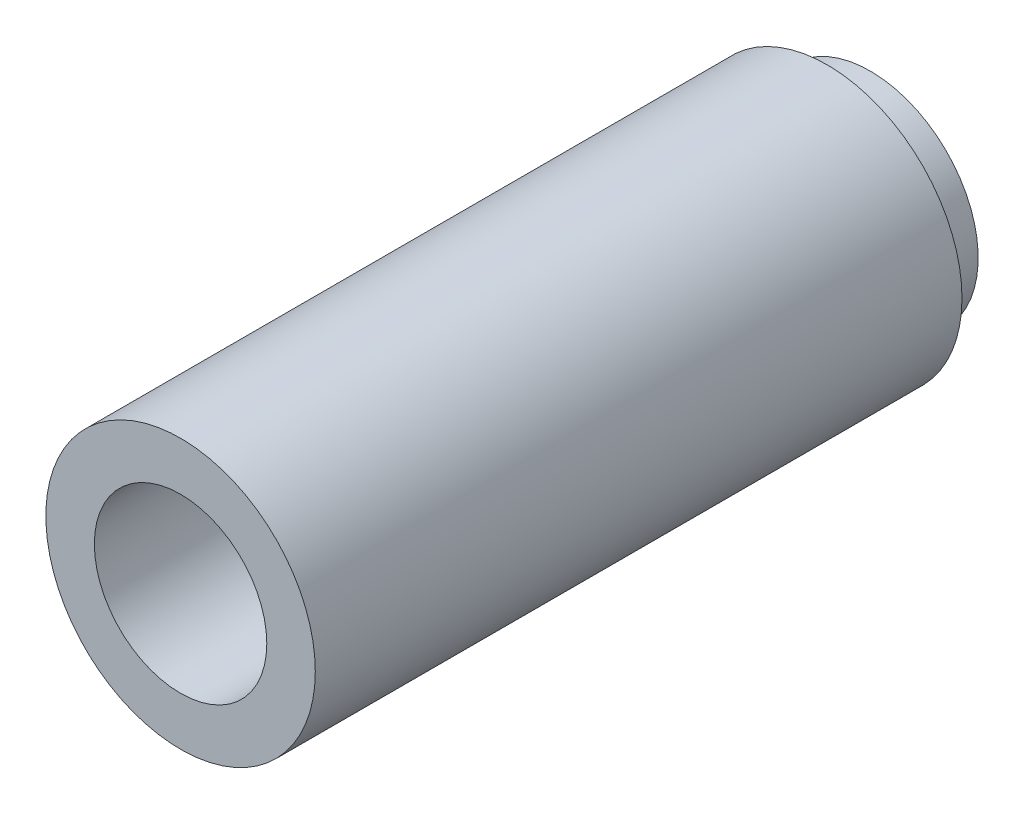
from build123d import *

# Parameters (mm, degrees)
SKETCH_1_R            = 12.5
EXTRUDE_1_DEPTH       = 60
SKETCH_2_R            = 10
EXTRUDE_2_DEPTH       = 4
OTHER_START           = 45
OTHER_1_OUTLINE_R     = 8
OTHER_1_DEPTH         = 15
M10X1_251_D           = 8.8
M10X1_251_DEPTH       = 40
M10X1_251_CBORE_D     = 10
M10X1_251_CBORE_DEPTH = 20
M10X1_251_TIP         = 2.643786724


# Read off the part's stored shape, not the designer's step: Полость1
with BuildPart() as part:
    # Эскиз1 → Бобышка-Вытянуть1 (new body)
    with BuildSketch(Plane.XY):
        with Locations((51.75, 69.5)):
            Circle(SKETCH_1_R)
    extrude(amount=EXTRUDE_1_DEPTH)

    # Эскиз2 → Бобышка-Вытянуть2 (add)
    with BuildSketch(Plane(origin=(0, 0, 0), x_dir=(-1, 0, 0), z_dir=(0, 0, -1))):
        with Locations((-51.75, 69.5)):
            Circle(SKETCH_2_R)
    extrude(amount=EXTRUDE_2_DEPTH)

    # Полость1 outline → Полость1 (cut)
    with BuildSketch(Plane.XY.offset(OTHER_START)):
        with Locations((51.75, 69.5)):
            Circle(OTHER_1_OUTLINE_R)
    extrude(amount=OTHER_1_DEPTH, mode=Mode.SUBTRACT)

    # Отверстие обработанное метчиком M10x1.251
    with Locations(Plane(origin=(0, 0, -4), x_dir=(-1, 0, 0), z_dir=(0, 0, -1))):
        with Locations((-51.75, 69.5)):
            CounterBoreHole(M10X1_251_D / 2, M10X1_251_CBORE_D / 2, M10X1_251_CBORE_DEPTH, depth=M10X1_251_DEPTH)
            with Locations((0, 0, -(M10X1_251_DEPTH + M10X1_251_TIP / 2))):  # 118° drill point
                Cone(0, M10X1_251_D / 2, M10X1_251_TIP, mode=Mode.SUBTRACT)


solid = part.part
